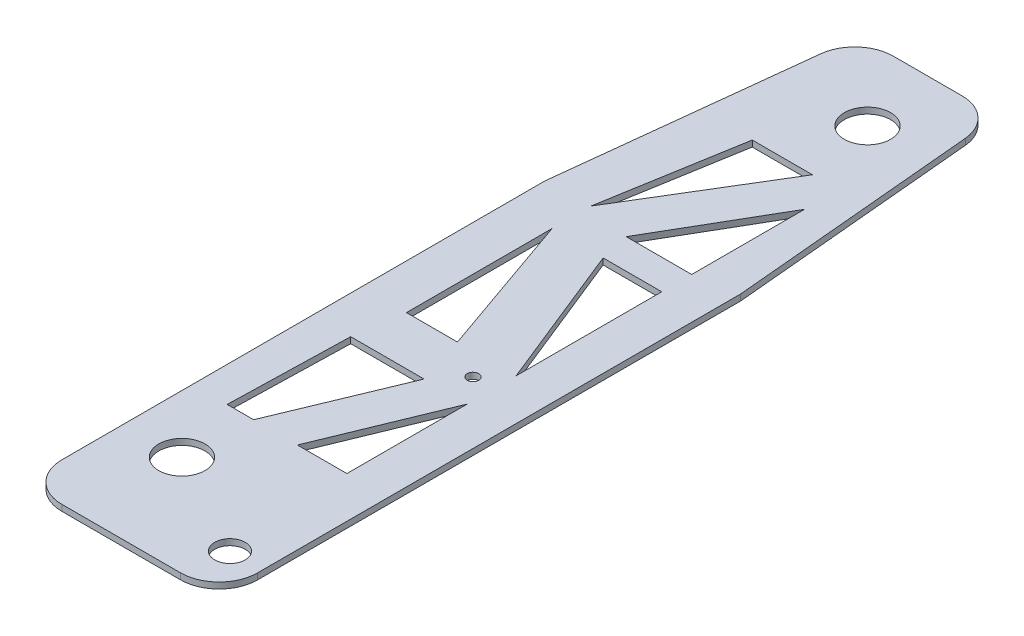
from build123d import *

# Parameters (mm, degrees)
SKETCH1_R           = 5.969
SKETCH1_R_2         = 3.960069723
SKETCH1_R_3         = 6
BOSS_EXTRUDE1_DEPTH = 1.5875
CUT_EXTRUDE1_DEPTH  = 10
SKETCH4_W           = 66.272407177
SKETCH4_H           = 27.800260981
CUT_EXTRUDE2_DEPTH  = 20
SKETCH5_R           = 6.683690244
BOSS_EXTRUDE2_DEPTH = 1.5875
SKETCH6_R           = 6
CUT_EXTRUDE3_DEPTH  = 2
FILLET3_R           = 10
SKETCH7_R           = 1.5
CUT_EXTRUDE4_DEPTH  = 3.175
FILLET4_R           = 10


with BuildPart() as part:
    # Sketch1 → Boss-Extrude1 (new body)
    with BuildSketch(Plane(origin=(0, 0, 0), x_dir=(1, 0, 0), z_dir=(0, 1, 0))):
        Polygon((42.32729629, 228.6), (10.454309325, 228.6), (0, 135.362739137), (0, 0), (24.327009544, 0), (50.8, 0), (50.8, 135.362739137), align=None)
        with Locations((24.327009544, 25.509186042)):
            Circle(SKETCH1_R, mode=Mode.SUBTRACT)
        with Locations((42.32729629, 11.29561028)):
            Circle(SKETCH1_R_2, mode=Mode.SUBTRACT)
        with Locations((29.504213454, 189.557234372)):
            Circle(SKETCH1_R_3, mode=Mode.SUBTRACT)
    extrude(amount=BOSS_EXTRUDE1_DEPTH)

    # Sketch2 → Cut-Extrude1 (cut)
    with BuildSketch(Plane(origin=(0, 1.5875, 0), x_dir=(1, 0, 0), z_dir=(0, 1, 0))):
        Polygon((17.710313686, 171.447292022), (11.625887928, 135.682824493), (33.327013171, 171.447292022), align=None)
        Polygon((40.069984314, 162.673375682), (40.069984314, 137.652327322), (40.069984314, 133.37242009), (23.073725904, 133.37242009), align=None)
        Polygon((11.625887928, 125.596148764), (11.625887928, 87.797541575), (24.859509964, 87.797541575), align=None)
        Polygon((24.859509964, 125.596148764), (40.069984314, 125.596148764), (40.069984314, 87.797541575), align=None)
        Polygon((28.8433603, 75.147356803), (9.809028696, 75.147356803), (9.002021985, 43.891436344), (15.87323788, 43.891436344), align=None)
        Polygon((40.069984314, 75.147356803), (40.069984314, 43.891436344), (31.278449047, 43.891436344), (27.238493662, 43.891436344), align=None)
    extrude(amount=-CUT_EXTRUDE1_DEPTH, mode=Mode.SUBTRACT)

    # Sketch4 → Cut-Extrude2 (cut)
    with BuildSketch(Plane(origin=(0, 0, -228.6), x_dir=(-1, 0, 0), z_dir=(0, 0, -1))):
        with Locations((-28.174690156, -1.980940155)):
            Rectangle(SKETCH4_W, SKETCH4_H)
    extrude(amount=-CUT_EXTRUDE2_DEPTH, mode=Mode.SUBTRACT)

    # Sketch5 → Boss-Extrude2 (add)
    with BuildSketch(Plane.XZ):
        with Locations((24.327009544, -25.509186042)):
            Circle(SKETCH5_R)
    extrude(amount=-BOSS_EXTRUDE2_DEPTH)

    # Sketch6 → Cut-Extrude3 (cut)
    with BuildSketch(Plane.XZ):
        with Locations((15, -26.149675445)):
            Circle(SKETCH6_R)
    extrude(amount=-CUT_EXTRUDE3_DEPTH, mode=Mode.SUBTRACT)

    # Fillet3
    fillet3_edges = [part.edges().sort_by_distance(p)[0] for p in [
        (44.144746445, 0.79375, -208.6),
    ]]
    fillet(fillet3_edges, radius=FILLET3_R)

    # Sketch7 → Cut-Extrude4 (cut)
    with BuildSketch(Plane.XZ):
        with Locations((34.714005998, -81.958115223)):
            Circle(SKETCH7_R)
    extrude(amount=-CUT_EXTRUDE4_DEPTH, mode=Mode.SUBTRACT)

    # Fillet4
    fillet4_edges = [part.edges().sort_by_distance(p)[0] for p in [
        (50.8, 0.79375, 0),
        (0, 0.79375, 0),
        (8.211791854, 0.79375, -208.6),
    ]]
    fillet(fillet4_edges, radius=FILLET4_R)


solid = part.part
